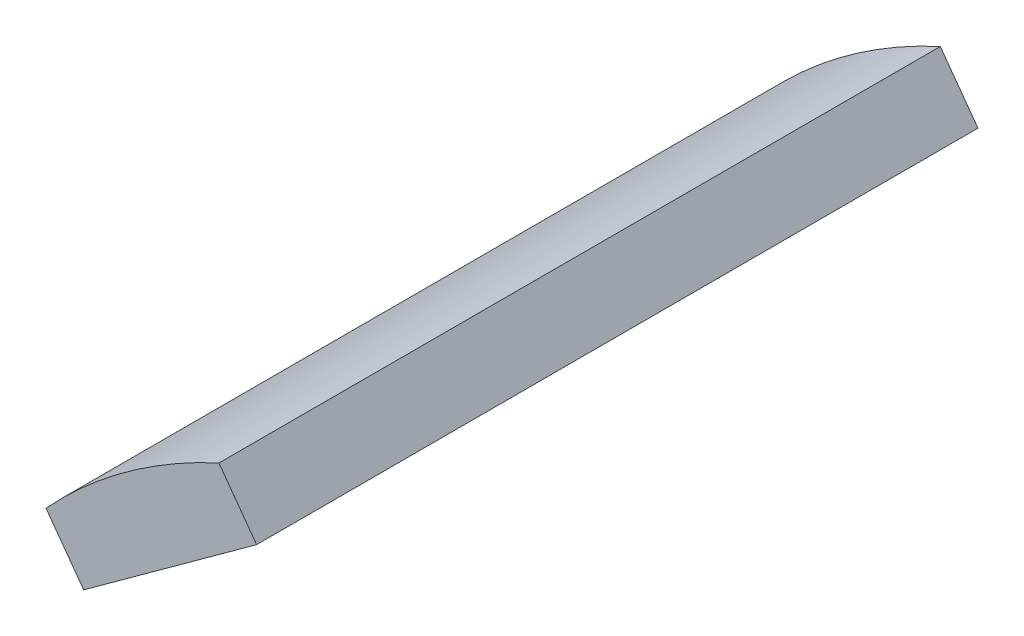
from build123d import *

# Parameters (mm, degrees)
BOSS_EXTRUDE2_DEPTH = 67.5


with BuildPart() as part:
    # Sketch1 → Boss-Extrude2 (new body)
    with BuildSketch(Plane.XY):
        with BuildLine():
            Line((-55.994668006, 60.057032519), (-39.814328118, 71.812737564))
            Line((-39.814328118, 71.812737564), (-43.341039632, 76.666839531))
            ThreePointArc((-43.341039632, 76.666839531), (-52.018994828, 71.598004002), (-59.521379519, 64.911134485))
            Line((-59.521379519, 64.911134485), (-55.994668006, 60.057032519))
        make_face()
    extrude(amount=BOSS_EXTRUDE2_DEPTH)


solid = part.part
